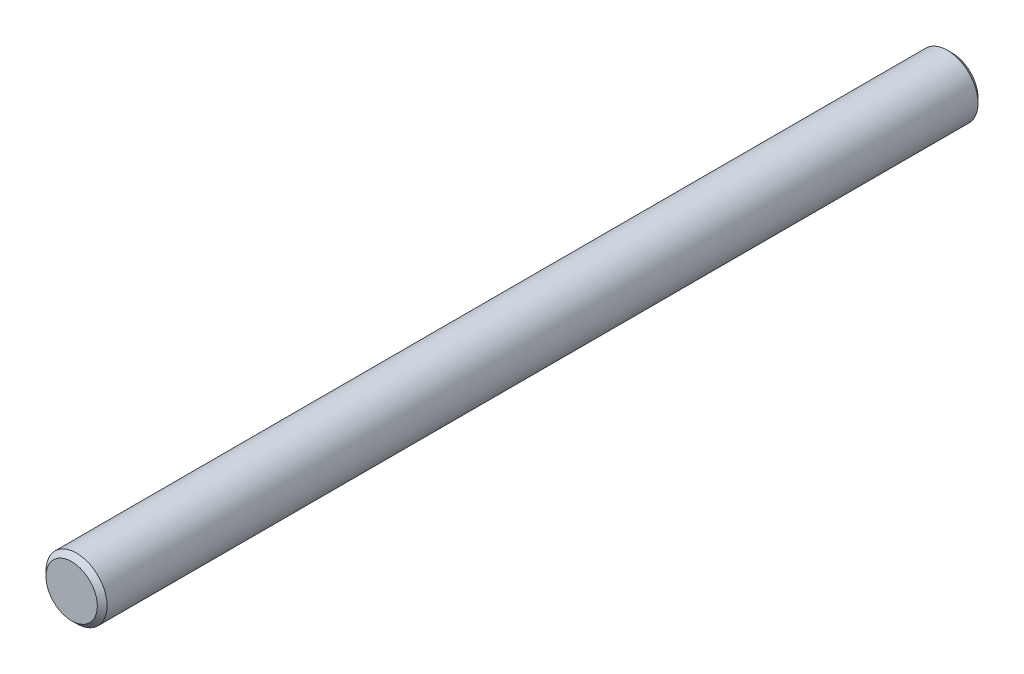
from build123d import *

# Parameters (mm, degrees)
SKETCH1_R           = 1.5875
BOSS_EXTRUDE1_DEPTH = 45.72
CHAMFER1_SIZE       = 0.254


with BuildPart() as part:
    # Sketch1 → Boss-Extrude1 (new body)
    with BuildSketch(Plane.XY):
        Circle(SKETCH1_R)
    extrude(amount=BOSS_EXTRUDE1_DEPTH)

    # Chamfer1
    chamfer1_edges = [part.edges().sort_by_distance(p)[0] for p in [
        (-1.5875, 0, 45.72),
        (-1.5875, 0, 0),
    ]]
    chamfer(chamfer1_edges, length=CHAMFER1_SIZE)


solid = part.part
